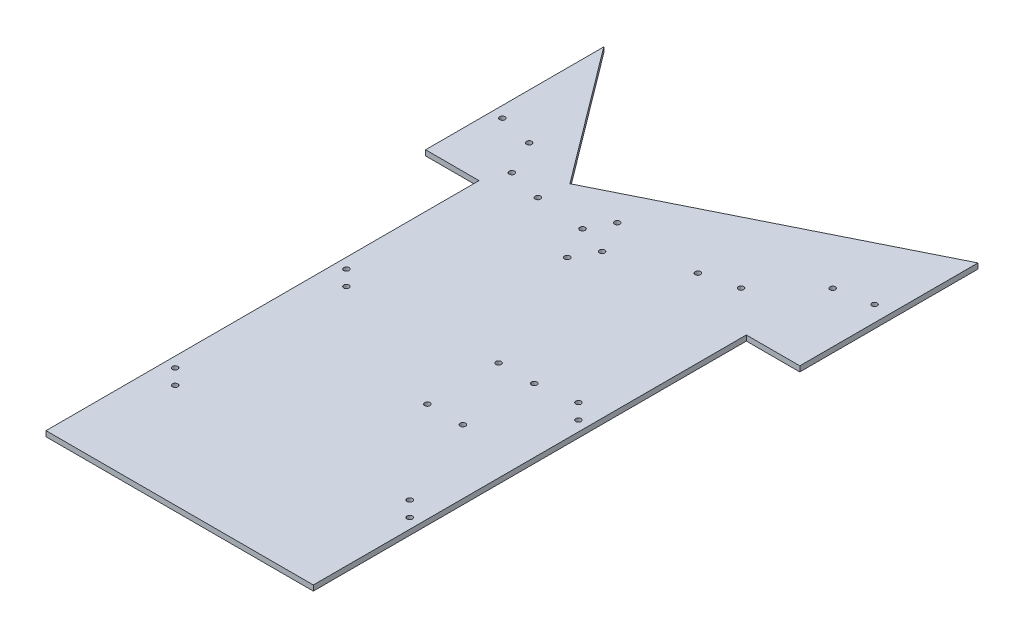
from build123d import *

# Parameters (mm, degrees)
SKETCH1_W           = 150
SKETCH1_H           = 200
SKETCH1_R           = 1.5
BOSS_EXTRUDE1_DEPTH = 3
SKETCH2_R           = 1.5
SKETCH2_R_2         = 1.500000004
SKETCH2_R_3         = 1.500000003
SKETCH2_R_4         = 1.499999997
BOSS_EXTRUDE3_DEPTH = 3


with BuildPart() as part:
    # Sketch1 → Boss-Extrude1 (new body)
    with BuildSketch(Plane(origin=(0, 0, 0), x_dir=(1, 0, 0), z_dir=(0, 1, 0))):
        Rectangle(SKETCH1_W, SKETCH1_H)
        with Locations((-69.242640687, 62.79605759)):
            Circle(SKETCH1_R, mode=Mode.SUBTRACT)
        with Locations((-60.757359313, 54.310776216)):
            Circle(SKETCH1_R, mode=Mode.SUBTRACT)
        with Locations((60.757359313, 63.034810844)):
            Circle(SKETCH1_R, mode=Mode.SUBTRACT)
        with Locations((69.242640687, 54.54952947)):
            Circle(SKETCH1_R, mode=Mode.SUBTRACT)
        with Locations((-69.242640687, -33.274226936)):
            Circle(SKETCH1_R, mode=Mode.SUBTRACT)
        with Locations((-60.757359313, -41.75950831)):
            Circle(SKETCH1_R, mode=Mode.SUBTRACT)
        with Locations((60.757359313, -31.641853854)):
            Circle(SKETCH1_R, mode=Mode.SUBTRACT)
        with Locations((69.242640687, -40.127135228)):
            Circle(SKETCH1_R, mode=Mode.SUBTRACT)
        with Locations((19.1, 59.87604307)):
            Circle(SKETCH1_R, mode=Mode.SUBTRACT)
        with Locations((39.1, 19.87604307)):
            Circle(SKETCH1_R, mode=Mode.SUBTRACT)
        with Locations((19.1, 19.87604307)):
            Circle(SKETCH1_R, mode=Mode.SUBTRACT)
        with Locations((39.1, 59.87604307)):
            Circle(SKETCH1_R, mode=Mode.SUBTRACT)
    extrude(amount=BOSS_EXTRUDE1_DEPTH)

    # Sketch2 → Boss-Extrude3 (add)
    with BuildSketch(Plane(origin=(0, 3, 0), x_dir=(1, 0, 0), z_dir=(0, 1, 0))):
        Polygon((-75, 100), (-75, 143), (-105, 143), (-105, 243), (-48, 167), (105, 243), (105, 143), (75, 143), (75, 100), align=None)
        with Locations((-12.871401164, 130.377195869)):
            Circle(SKETCH2_R, mode=Mode.SUBTRACT)
        with Locations((-6.031802552, 143.074435365)):
            Circle(SKETCH2_R, mode=Mode.SUBTRACT)
        with Locations((-15.737183302, 161.327601796)):
            Circle(SKETCH2_R, mode=Mode.SUBTRACT)
        with Locations((-22.576781914, 148.6303623)):
            Circle(SKETCH2_R, mode=Mode.SUBTRACT)
        with Locations((31.340042847, 159.444468605)):
            Circle(SKETCH2_R_2, mode=Mode.SUBTRACT)
        with Locations((50.742574777, 164.296453221)):
            Circle(SKETCH2_R_2, mode=Mode.SUBTRACT)
        with Locations((76.536595954, 189.883247413)):
            Circle(SKETCH2_R_3, mode=Mode.SUBTRACT)
        with Locations((96.155699061, 193.767934437)):
            Circle(SKETCH2_R_3, mode=Mode.SUBTRACT)
        with Locations((-50.270108513, 151.236438255)):
            Circle(SKETCH2_R_4, mode=Mode.SUBTRACT)
        with Locations((-69.672640443, 156.088422871)):
            Circle(SKETCH2_R_4, mode=Mode.SUBTRACT)
        with Locations((-79.321204369, 175.416451103)):
            Circle(SKETCH2_R_4, mode=Mode.SUBTRACT)
        with Locations((-98.81252438, 179.898464513)):
            Circle(SKETCH2_R_4, mode=Mode.SUBTRACT)
    extrude(amount=-BOSS_EXTRUDE3_DEPTH)


solid = part.part
